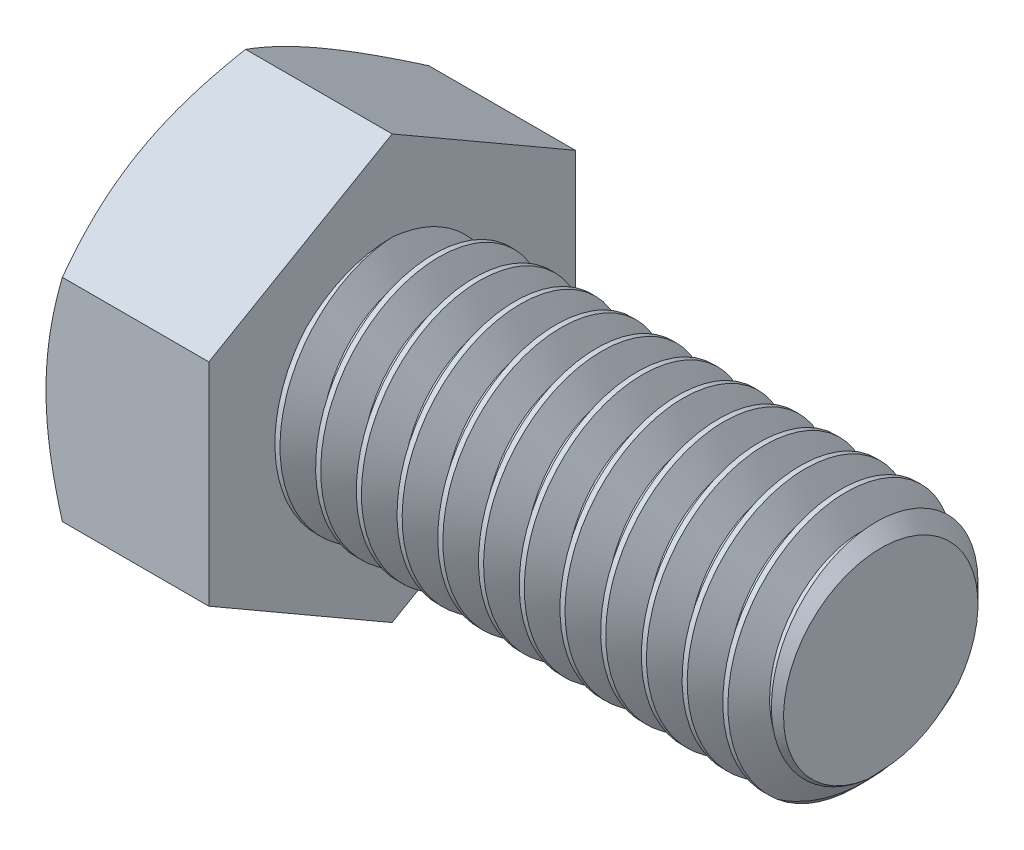
from build123d import *

# Parameters (mm, degrees)
SKETCH5_R           = 4.7625
BOSS_EXTRUDE3_DEPTH = 19.05
CHAMFER1_SIZE       = 0.97155
CUT_SWEEP1_PITCH    = 1.5875
BOSS_EXTRUDE4_DEPTH = 6.35
SKETCH8_OUTSIDE_W   = 122.214
SKETCH8_OUTSIDE_H   = 124.424
SKETCH8_OUTSIDE_R   = 7.14375
CUT_EXTRUDE3_DEPTH  = 28.644843841
CUT_EXTRUDE3_DRAFT  = -60
CUT_EXTRUDE4_DEPTH  = 0.254
CIRPATTERN1_COUNT   = 3


with BuildPart() as part:
    # Sketch5 → Boss-Extrude3 (new body)
    with BuildSketch(Plane(origin=(12.7, 0, 0), x_dir=(0, 0, -1), z_dir=(1, 0, 0))):
        Circle(SKETCH5_R)
    extrude(amount=-BOSS_EXTRUDE3_DEPTH)

    # Chamfer1
    chamfer1_edges = [part.edges().sort_by_distance(p)[0] for p in [
        (12.7, 0, 4.7625),
    ]]
    chamfer(chamfer1_edges, length=CHAMFER1_SIZE)

    # Cut-Sweep1: the profile of Sketch10 profile screwed along a right-hand helix of 13 turns, 8 arcs to a turn; built about Z, then put on its axis
    cut_sweep1_z = Axis((0, 0, 0), (0, 0, 1))
    cut_sweep1_corners = [(4.7628, 0, 0.000173205), (3.731388504, 0, -0.5953125), (3.731388504, 0, -0.79375), (4.7628, 0, -1.389235705)]
    with BuildLine(mode=Mode.PRIVATE) as cut_sweep1_profile:
        Line(cut_sweep1_corners[0], cut_sweep1_corners[1])
        Line(cut_sweep1_corners[1], cut_sweep1_corners[2])
        Line(cut_sweep1_corners[2], cut_sweep1_corners[3])
        Line(cut_sweep1_corners[3], cut_sweep1_corners[0])
    cut_sweep1_cap = Face(cut_sweep1_profile.wire())
    cut_sweep1_turn_angles = [0, 22.5, 45, 67.5, 90, 112.5, 135, 157.5, 180, 202.5, 225, 247.5, 270, 292.5, 315, 337.5, 360]
    cut_sweep1_turn_weights = [1, 0.9238795325112867, 1, 0.9238795325112867, 1, 0.9238795325112867, 1, 0.9238795325112867, 1, 0.9238795325112867, 1, 0.9238795325112867, 1, 0.9238795325112867, 1, 0.9238795325112867, 1]
    cut_sweep1_turn_rails = [Edge.make_bspline([Vector(p[0], p[1], 0).rotate(cut_sweep1_z, cut_sweep1_turn_angles[k]) / cut_sweep1_turn_weights[k] + Vector(0, 0, p[2] + CUT_SWEEP1_PITCH * cut_sweep1_turn_angles[k] / 360) for k in range(17)], [0, 0, 0, 1, 1, 2, 2, 3, 3, 4, 4, 5, 5, 6, 6, 7, 7, 8, 8, 8], 2, cut_sweep1_turn_weights) for p in cut_sweep1_corners]
    cut_sweep1_turn_sides = [Face.make_surface_from_curves(cut_sweep1_turn_rails[p[0]], cut_sweep1_turn_rails[p[1]]) for p in [(0, 1), (1, 2), (2, 3), (3, 0)]]
    cut_sweep1 = Plane(origin=(12.7, 0, 0), x_dir=(0, 1, 0), z_dir=(-1, 0, 0)) * Solid(Shell([*[p.moved(Location((0, 0, CUT_SWEEP1_PITCH * i))) for i in range(13) for p in cut_sweep1_turn_sides], cut_sweep1_cap, cut_sweep1_cap.rotate(cut_sweep1_z, 4680).moved(Location((0, 0, CUT_SWEEP1_PITCH * 4680 / 360)))]))
    add(cut_sweep1, mode=Mode.SUBTRACT)

    # Sketch6 → Boss-Extrude4 (add)
    with BuildSketch(Plane.ZY.offset(6.35)):
        Polygon((7.14375, 4.124445986), (0, 8.248891971), (-7.14375, 4.124445986), (-7.14375, -4.124445986), (0, -8.248891971), (7.14375, -4.124445986), align=None)
    extrude(amount=BOSS_EXTRUDE4_DEPTH)


with BuildPart() as cut_extrude3_tool:
    # Sketch8 outside → Cut-Extrude3 (with draft: the straight prism first)
    with BuildSketch(Plane.ZY.offset(12.7)):
        Rectangle(SKETCH8_OUTSIDE_W, SKETCH8_OUTSIDE_H)
        Circle(SKETCH8_OUTSIDE_R, mode=Mode.SUBTRACT)
    extrude(amount=-CUT_EXTRUDE3_DEPTH)
    # Cut-Extrude3: the draft: its side faces are tilted about the plane it starts from
    cut_extrude3_sides = [cut_extrude3_tool.faces().sort_by_distance(p)[0] for p in [
        (1.62242192, -62.212, 0),
        (1.62242192, 0, 61.107),
        (1.62242192, 62.212, 0),
        (1.62242192, 0, -61.107),
        (1.62242192, 0, -7.14375),
    ]]
    draft(cut_extrude3_sides, Plane.ZY.offset(12.7), CUT_EXTRUDE3_DRAFT)


with BuildPart() as part_1:
    add(part.part)

    # Cut-Extrude3: cut by cut_extrude3_tool
    add(cut_extrude3_tool.part, mode=Mode.SUBTRACT)

    # Sketch12 → Cut-Extrude4 (cut)
    with BuildSketch(Plane.ZY.offset(12.7)):
        with BuildLine():
            Line((0.2143125, 5.5006875), (0.2143125, 3.0718125))
            ThreePointArc((0.2143125, 3.0718125), (0, 2.8575), (-0.2143125, 3.0718125))
            Line((-0.2143125, 3.0718125), (-0.2143125, 5.5006875))
            ThreePointArc((-0.2143125, 5.5006875), (0, 5.715), (0.2143125, 5.5006875))
        make_face()
    cut_extrude4 = extrude(amount=-CUT_EXTRUDE4_DEPTH, mode=Mode.SUBTRACT)

    # CirPattern1: Cut-Extrude4 ×3 about axis
    cirpattern1_axis = Axis((0, 0, 0), (1, 0, 0))
    for i in range(1, CIRPATTERN1_COUNT):
        add(cut_extrude4.rotate(cirpattern1_axis, i * 360 / CIRPATTERN1_COUNT), mode=Mode.SUBTRACT)


solid = part_1.part
